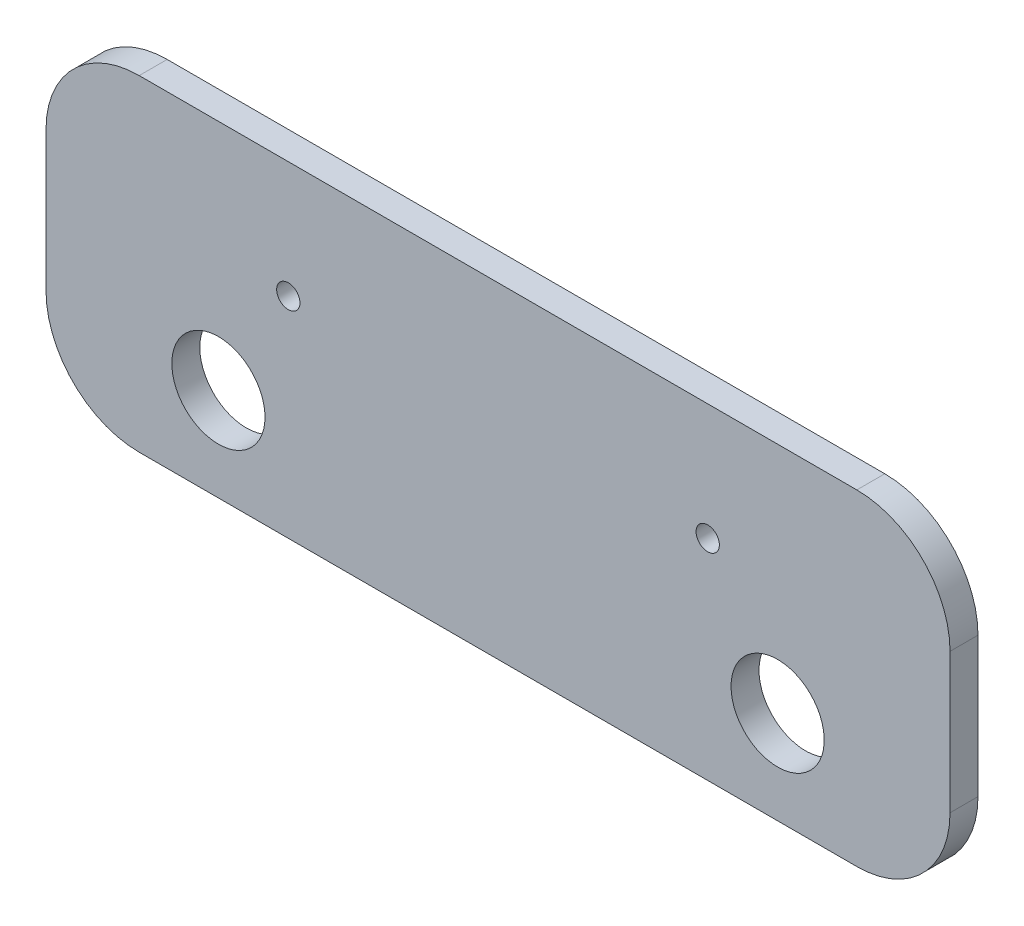
from build123d import *

# Parameters (mm, degrees)
SKETCH_1_W          = 91
SKETCH_1_H          = 35
EXTRUDE_2_DEPTH     = 3
SKETCH_2_R          = 1.25
CUT_EXTRUDE_1_DEPTH = 3
SKETCH_3_W          = 91
SKETCH_3_H          = 3
EXTRUDE_3_DEPTH     = 12
EXTRUDE_4_DEPTH     = 3
SKETCH_6_R          = 1.25
CUT_EXTRUDE_2_DEPTH = 3
SKETCH_7_W          = 27
SKETCH_7_H          = 35
EXTRUDE_5_DEPTH     = 3
SKETCH_8_R          = 1.25
CUT_EXTRUDE_3_DEPTH = 3
CUT_EXTRUDE_4_DEPTH = 57.669628421
SKETCH_10_R         = 5
CUT_EXTRUDE_5_DEPTH = 57.669628421
FILLET_1_R          = 10


with BuildPart() as part:
    # 草图1 → 凸台-拉伸2 (new body)
    with BuildSketch(Plane.XY):
        Rectangle(SKETCH_1_W, SKETCH_1_H)
    extrude(amount=EXTRUDE_2_DEPTH)

    # 草图2 → 切除-拉伸1 (cut)
    with BuildSketch(Plane(origin=(0, 0, 0), x_dir=(-1, 0, 0), z_dir=(0, 0, -1))):
        with Locations((-22.5, 5)):
            Circle(SKETCH_2_R)
        with Locations((22.5, 5)):
            Circle(SKETCH_2_R)
    extrude(amount=-CUT_EXTRUDE_1_DEPTH, mode=Mode.SUBTRACT)

    # 草图3 → 凸台-拉伸3 (add)
    with BuildSketch(Plane(origin=(0, 0, 0), x_dir=(-1, 0, 0), z_dir=(0, 0, -1))):
        with Locations((0, 16)):
            Rectangle(SKETCH_3_W, SKETCH_3_H)
    extrude(amount=EXTRUDE_3_DEPTH)

    # 草图4 → 凸台-拉伸4 (add)
    with BuildSketch(Plane(origin=(45.5, 0, 0), x_dir=(0, 0, -1), z_dir=(1, 0, 0))):
        Polygon((12, 17.5), (24, 17.5), (24, -17.5), (-3, -17.5), (-3, 17.5), align=None)
    extrude(amount=EXTRUDE_4_DEPTH)

    # 草图6 → 切除-拉伸2 (cut)
    with BuildSketch(Plane.ZY.offset(-45.5)):
        with Locations((-20, 9.5)):
            Circle(SKETCH_6_R)
        with Locations((-20, -15.5)):
            Circle(SKETCH_6_R)
    extrude(amount=-CUT_EXTRUDE_2_DEPTH, mode=Mode.SUBTRACT)

    # 草图7 → 凸台-拉伸5 (add)
    with BuildSketch(Plane.ZY.offset(45.5)):
        with Locations((-10.5, 0)):
            Rectangle(SKETCH_7_W, SKETCH_7_H)
    extrude(amount=EXTRUDE_5_DEPTH)

    # 草图8 → 切除-拉伸3 (cut)
    with BuildSketch(Plane.ZY.offset(48.5)):
        with Locations((-20, 9.5)):
            Circle(SKETCH_8_R)
        with Locations((-20, -15.5)):
            Circle(SKETCH_8_R)
    extrude(amount=-CUT_EXTRUDE_3_DEPTH, mode=Mode.SUBTRACT)

    # 草图9 → 切除-拉伸4 (cut)
    with BuildSketch(Plane(origin=(0, 0, 0), x_dir=(-1, 0, 0), z_dir=(0, 0, -1))):
        Polygon((-104.540404499, 43.487772061), (97.135742415, 67.997211031), (114.089056769, -71.503294087), (-87.587090144, -96.012733056), align=None)
    extrude(amount=CUT_EXTRUDE_4_DEPTH, mode=Mode.SUBTRACT)

    # 草图10 → 切除-拉伸5 (cut)
    with BuildSketch(Plane.XY.offset(3)):
        with Locations((-30, -7.5)):
            Circle(SKETCH_10_R)
        with Locations((30, -7.5)):
            Circle(SKETCH_10_R)
    extrude(amount=-CUT_EXTRUDE_5_DEPTH, mode=Mode.SUBTRACT)

    # 圆角1
    fillet_1_edges = [part.edges().sort_by_distance(p)[0] for p in [
        (48.5, 17.5, 1.5),
        (48.5, -17.5, 1.5),
        (-48.5, 17.5, 1.5),
        (-48.5, -17.5, 1.5),
    ]]
    fillet(fillet_1_edges, radius=FILLET_1_R)


solid = part.part
